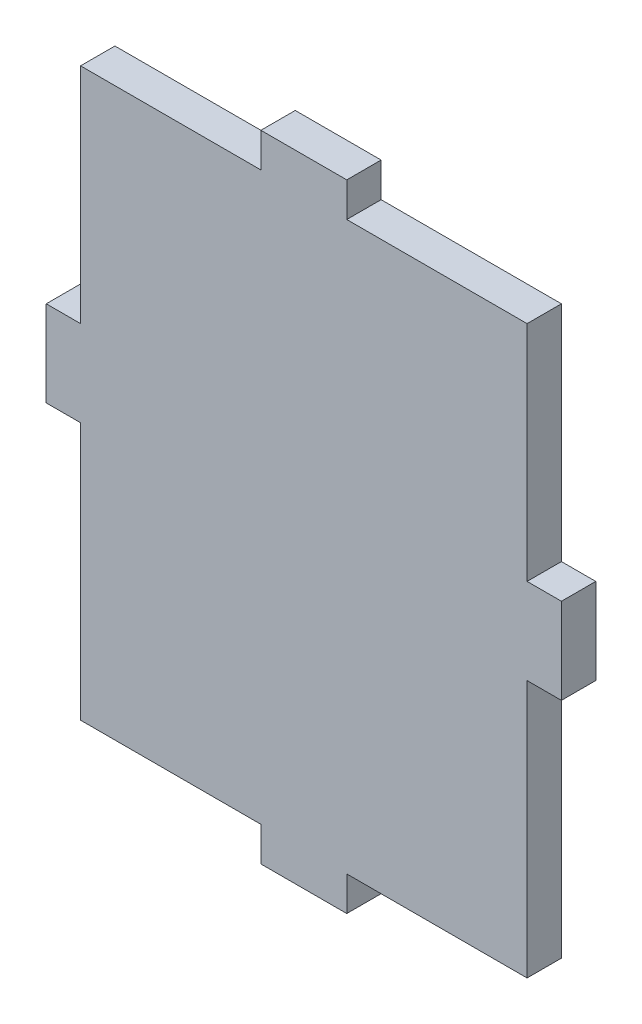
from build123d import *

# Parameters (mm, degrees)
SKETCH1_W           = 52
SKETCH1_H           = 66
BOSS_EXTRUDE1_DEPTH = 4
SKETCH2_W           = 4
SKETCH2_H           = 10
SKETCH2_W_2         = 10
SKETCH2_H_2         = 4
BOSS_EXTRUDE2_DEPTH = 4


with BuildPart() as part:
    # Sketch1 → Boss-Extrude1 (new body)
    with BuildSketch(Plane.XY):
        with Locations((26, 33)):
            Rectangle(SKETCH1_W, SKETCH1_H)
    extrude(amount=BOSS_EXTRUDE1_DEPTH)

    # Sketch2 → Boss-Extrude2 (add)
    with BuildSketch(Plane.XY.offset(4)):
        with Locations((-2, 35)):
            Rectangle(SKETCH2_W, SKETCH2_H)
        with Locations((54, 35)):
            Rectangle(SKETCH2_W, SKETCH2_H)
        with Locations((26, -2)):
            Rectangle(SKETCH2_W_2, SKETCH2_H_2)
        with Locations((26, 68)):
            Rectangle(SKETCH2_W_2, SKETCH2_H_2)
    extrude(amount=-BOSS_EXTRUDE2_DEPTH)


solid = part.part
